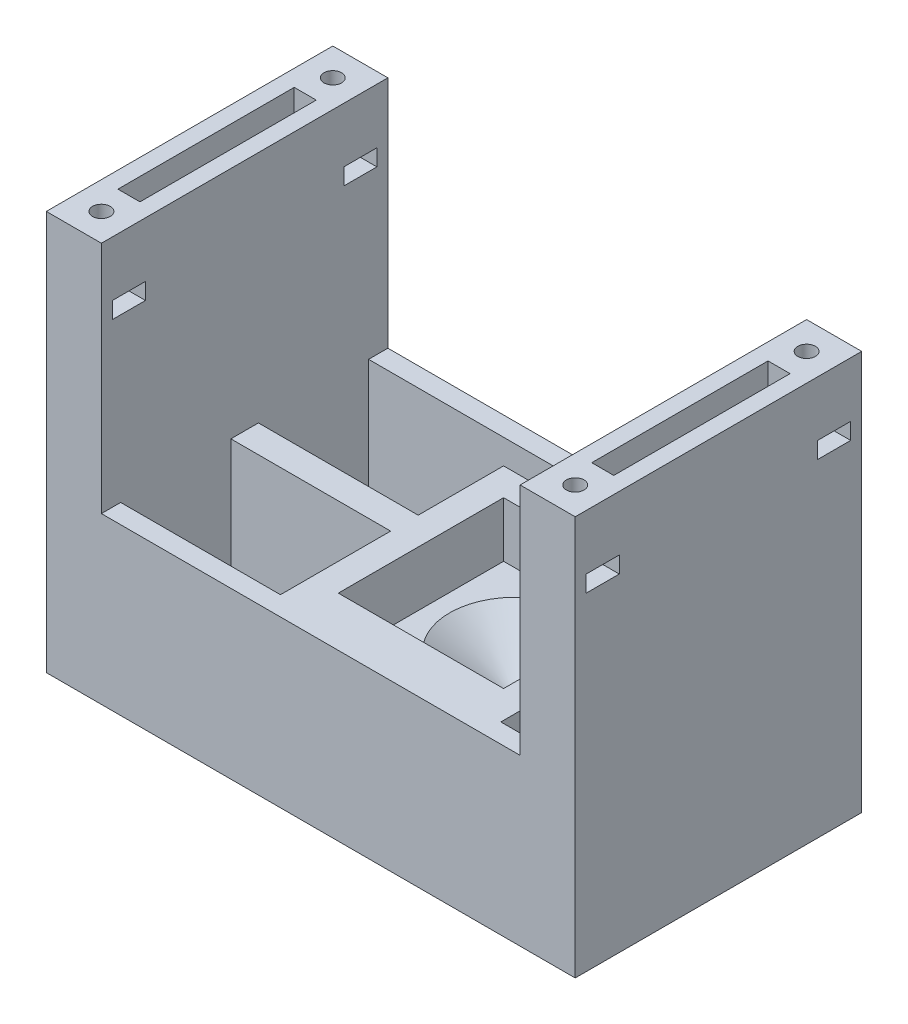
from build123d import *

# Parameters (mm, degrees)
SKETCH1_W           = 96
SKETCH1_H           = 52
BOSS_EXTRUDE1_DEPTH = 30
SKETCH3_W           = 30
SKETCH3_H           = 30
CUT_EXTRUDE1_DEPTH  = 10
SKETCH4_W           = 10
SKETCH4_H           = 52
BOSS_EXTRUDE2_DEPTH = 42.5
CUT_EXTRUDE2_DEPTH  = 25
SKETCH6_R           = 1.8
CUT_EXTRUDE3_DEPTH  = 99.250954194
SKETCH7_R           = 10
SKETCH7_R_2         = 4
CUT_EXTRUDE4_DEPTH  = 10
FILLET2_R           = 2
FILLET3_R           = 4
CHAMFER1_SIZE       = 10
CHAMFER1_SIZE2      = 7.002075382
SKETCH10_W          = 6
SKETCH10_H          = 3
CUT_EXTRUDE7_DEPTH  = 124.078227157
SKETCH11_R          = 1.6
SKETCH11_W          = 4
SKETCH11_H          = 32
CUT_EXTRUDE8_DEPTH  = 60


with BuildPart() as part:
    # Sketch1 → Boss-Extrude1 (new body)
    with BuildSketch(Plane(origin=(0, 0, 0), x_dir=(1, 0, 0), z_dir=(0, 1, 0))):
        with Locations((-13, 0)):
            Rectangle(SKETCH1_W, SKETCH1_H)
    extrude(amount=BOSS_EXTRUDE1_DEPTH)

    # Sketch3 → Cut-Extrude1 (cut)
    with BuildSketch(Plane(origin=(0, 30, 0), x_dir=(1, 0, 0), z_dir=(0, 1, 0))):
        with Locations((-2, -2)):
            Rectangle(SKETCH3_W, SKETCH3_H)
    extrude(amount=-CUT_EXTRUDE1_DEPTH, mode=Mode.SUBTRACT)

    # Sketch4 → Boss-Extrude2 (add)
    with BuildSketch(Plane(origin=(0, 30, 0), x_dir=(1, 0, 0), z_dir=(0, 1, 0))):
        with Locations((30, 0)):
            Rectangle(SKETCH4_W, SKETCH4_H)
        with Locations((-56, 0)):
            Rectangle(SKETCH4_W, SKETCH4_H)
    extrude(amount=BOSS_EXTRUDE2_DEPTH)

    # Sketch5 → Cut-Extrude2 (cut)
    with BuildSketch(Plane(origin=(0, 30, 0), x_dir=(1, 0, 0), z_dir=(0, 1, 0))):
        Polygon((25, 22.5), (0.5, 22.5), (0.5, 18), (18, 18), (18, 2.5), (25, 2.5), align=None)
        Polygon((-4.5, 22.5), (-51, 22.5), (-51, 2.5), (-22, 2.5), (-22, 18), (-4.5, 18), align=None)
        Polygon((-22, -2.5), (-51, -2.5), (-51, -22.5), (-22, -22.5), (-22, -20), align=None)
        Polygon((25, -22.5), (25, -2.5), (18, -2.5), (18, -20), (18, -22.5), align=None)
    extrude(amount=-CUT_EXTRUDE2_DEPTH, mode=Mode.SUBTRACT)

    # Sketch6 → Cut-Extrude3 (cut, through all)
    with BuildSketch(Plane.XZ):
        with Locations(Location((-2, 0, 0), (0, 0, 270))):
            Circle(SKETCH6_R)
    extrude(amount=-CUT_EXTRUDE3_DEPTH, mode=Mode.SUBTRACT)

    # Sketch7 → Cut-Extrude4 (cut)
    with BuildSketch(Plane.XZ):
        with Locations(Location((-2, 0, 0), (0, 0, 270))):
            Circle(SKETCH7_R)
        with Locations(Location((-2, 0, 0), (0, 0, 270))):
            Circle(SKETCH7_R_2, mode=Mode.SUBTRACT)
    extrude(amount=-CUT_EXTRUDE4_DEPTH, mode=Mode.SUBTRACT)

    # Fillet2
    fillet2_edges = [part.edges().sort_by_distance(p)[0] for p in [
        (-2, 10, 4),
    ]]
    fillet(fillet2_edges, radius=FILLET2_R)

    # Fillet3
    fillet3_edges = [part.edges().sort_by_distance(p)[0] for p in [
        (-2, 10, 10),
    ]]
    fillet(fillet3_edges, radius=FILLET3_R - 0.0001)  # a hair under: the kernel refuses the full size

    # Chamfer1
    chamfer1_edges = [part.edges().sort_by_distance(p)[0] for p in [
        (-2, 20, 1.8),
    ]]
    chamfer1_side = [part.faces().sort_by_distance(p)[0] for p in [
        (-2, 20, 2.022878214),
    ]]
    chamfer(chamfer1_edges, length=CHAMFER1_SIZE, length2=CHAMFER1_SIZE2, reference=chamfer1_side[0])

    # Sketch10 → Cut-Extrude7 (cut, through all)
    with BuildSketch(Plane(origin=(35, 0, 0), x_dir=(0, 0, -1), z_dir=(1, 0, 0))):
        with Locations((21, 61)):
            Rectangle(SKETCH10_W, SKETCH10_H)
        with Locations((-21, 61)):
            Rectangle(SKETCH10_W, SKETCH10_H)
    extrude(amount=-CUT_EXTRUDE7_DEPTH, mode=Mode.SUBTRACT)

    # Sketch11 → Cut-Extrude8 (cut)
    with BuildSketch(Plane(origin=(0, 72.5, 0), x_dir=(1, 0, 0), z_dir=(0, 1, 0))):
        with Locations(Location((-56, 21, 0), (0, 0, 270))):
            Circle(SKETCH11_R)
        with Locations(Location((-56, -21, 0), (0, 0, 270))):
            Circle(SKETCH11_R)
        with Locations(Location((30, -21, 0), (0, 0, 270))):
            Circle(SKETCH11_R)
        with Locations(Location((30, 21, 0), (0, 0, 270))):
            Circle(SKETCH11_R)
        with Locations((-56, 0)):
            Rectangle(SKETCH11_W, SKETCH11_H)
        with Locations((30, 0)):
            Rectangle(SKETCH11_W, SKETCH11_H)
    extrude(amount=-CUT_EXTRUDE8_DEPTH, mode=Mode.SUBTRACT)


solid = part.part
